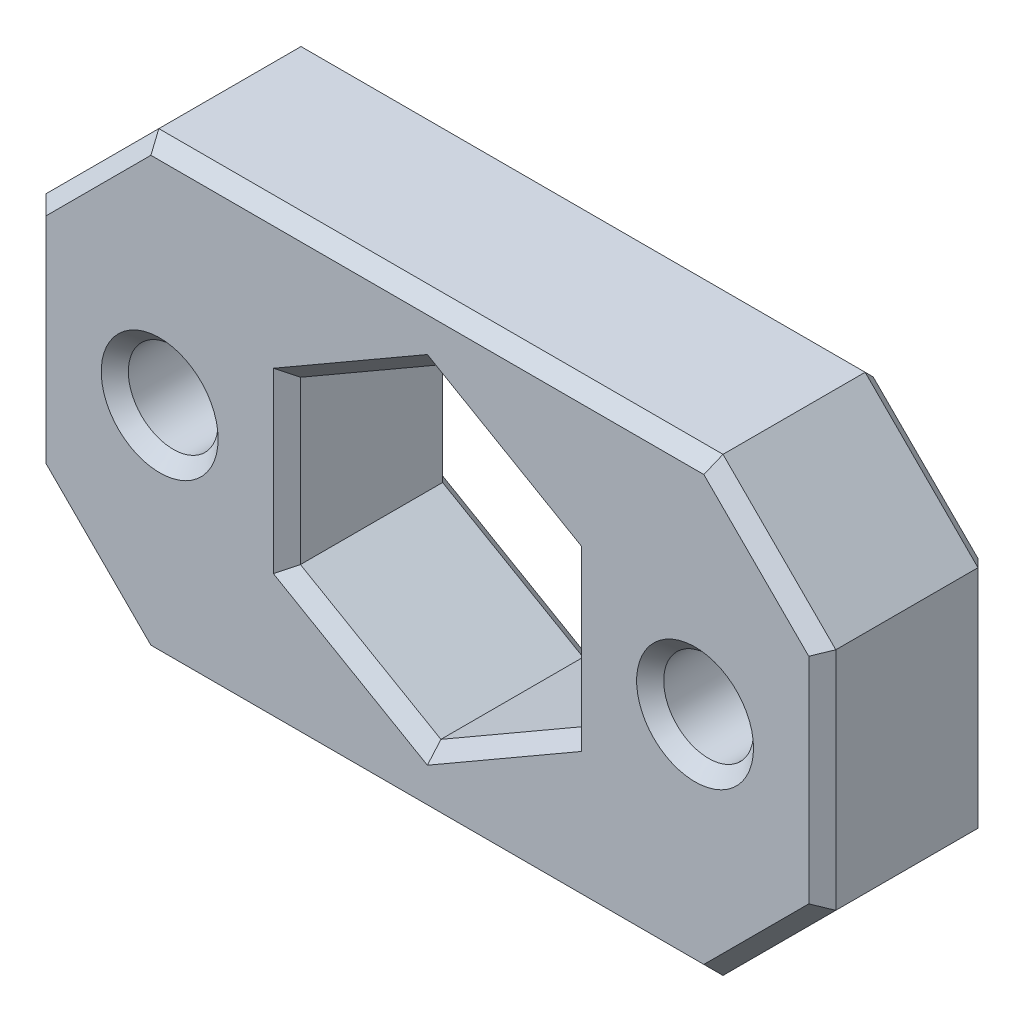
from build123d import *

# Parameters (mm, degrees)
SKETCH1_W                  = 44.45
SKETCH1_H                  = 25.4
BOSS_EXTRUDE1_DEPTH        = 9.525
CHAMFER1_SIZE              = 6.35
HOLE1_AT_2_COUNT           = 2
HOLE1_AT_2_PITCH           = 30.13075
F_8_0_199_DIAMETER_HOLE1_D = 5.0546
CHAMFER2_SIZE              = 0.762


with BuildPart() as part:
    # Sketch1 → Boss-Extrude1 (new body)
    with BuildSketch(Plane.XY):
        with Locations((35.268404938, -193.371995598)):
            Rectangle(SKETCH1_W, SKETCH1_H)
        Polygon((43.174154938, -197.936382488), (43.174154938, -188.807608707), (35.268404938, -184.243221816), (27.362654938, -188.807608707), (27.362654938, -197.936382488), (35.268404938, -202.500769379), align=None, mode=Mode.SUBTRACT)
    extrude(amount=BOSS_EXTRUDE1_DEPTH)

    # Chamfer1
    chamfer1_edges = [part.edges().sort_by_distance(p)[0] for p in [
        (57.493404938, -180.671995598, 4.7625),
        (57.493404938, -206.071995598, 4.7625),
        (13.043404938, -206.071995598, 4.7625),
        (13.043404938, -180.671995598, 4.7625),
    ]]
    chamfer(chamfer1_edges, length=CHAMFER1_SIZE)

    # Sketch3 → Hole1 (revolve, cut)
    with BuildSketch(Plane(origin=(20.203029938, -193.371995598, 0), x_dir=(0, 1, 0), z_dir=(1, 0, 0))):
        Polygon((0, 0), (0, 4.699), (2.8702, 4.699), (2.9972, 0), align=None)
    hole1 = revolve(axis=Axis((20.203029938, -193.371995598, 110), (0, 0, -1)), mode=Mode.SUBTRACT)

    # Hole1 at 2: Hole1 ×2
    with Locations(*[(i * HOLE1_AT_2_PITCH, 0, 0) for i in range(1, HOLE1_AT_2_COUNT)]):
        add(hole1, mode=Mode.SUBTRACT)

    # #8 (0.199) Diameter Hole1 (through all)
    with Locations(Plane(origin=(0, 0, 0), x_dir=(-1, 0, 0), z_dir=(0, 0, -1))):
        with Locations((-50.333779938, -193.371995598), (-20.203029938, -193.371995598)):
            Hole(F_8_0_199_DIAMETER_HOLE1_D / 2)

    # Chamfer2
    chamfer2_edges = [part.edges().sort_by_distance(p)[0] for p in [
        (54.318404938, -202.896995598, 0),
        (57.493404938, -193.371995598, 0),
        (35.268404938, -180.671995598, 0),
        (54.318404938, -183.846995598, 0),
        (47.806479938, -193.371995598, 9.525),
        (39.221279938, -186.525415262, 9.525),
        (31.315529938, -186.525415262, 9.525),
        (27.362654938, -193.371995598, 9.525),
        (31.315529938, -200.218575934, 9.525),
        (39.221279938, -200.218575934, 9.525),
        (43.174154938, -193.371995598, 9.525),
        (54.318404938, -202.896995598, 9.525),
        (35.268404938, -206.071995598, 9.525),
        (16.218404938, -202.896995598, 9.525),
        (13.043404938, -193.371995598, 9.525),
        (16.218404938, -183.846995598, 9.525),
        (35.268404938, -180.671995598, 9.525),
        (54.318404938, -183.846995598, 9.525),
        (57.493404938, -193.371995598, 9.525),
        (17.675729938, -193.371995598, 9.525),
        (39.221279938, -200.218575934, 0),
        (31.315529938, -200.218575934, 0),
        (27.362654938, -193.371995598, 0),
        (31.315529938, -186.525415262, 0),
        (39.221279938, -186.525415262, 0),
        (43.174154938, -193.371995598, 0),
        (35.268404938, -206.071995598, 0),
        (16.218404938, -202.896995598, 0),
        (13.043404938, -193.371995598, 0),
        (16.218404938, -183.846995598, 0),
    ]]
    chamfer(chamfer2_edges, length=CHAMFER2_SIZE)


solid = part.part
